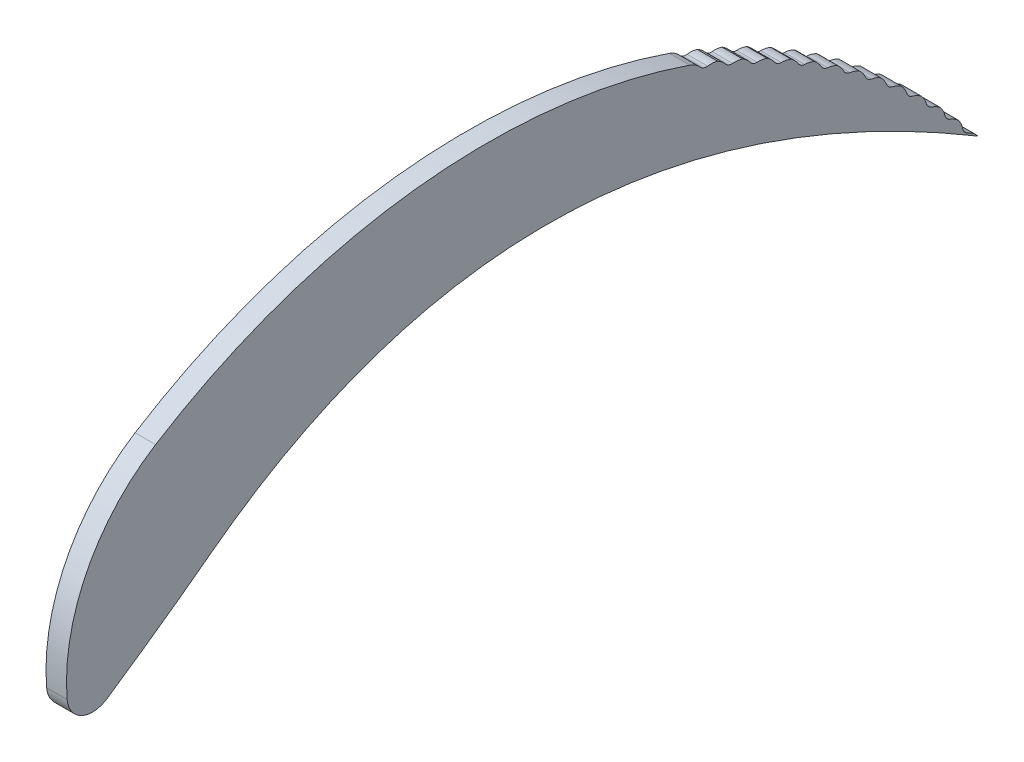
from build123d import *

# Parameters (mm, degrees)
BOSS_EXTRUDE1_DEPTH = 2.54
CUT_EXTRUDE1_START  = -2.54
CUT_EXTRUDE1_DEPTH  = 2.54
CIRPATTERN1_COUNT   = 27
CIRPATTERN1_ANGLE   = 65
FILLET1_R           = 3.048


with BuildPart() as part:
    # Sketch1 → Boss-Extrude1 (new body)
    with BuildSketch(Plane(origin=(0, 0, 0), x_dir=(0, 0, -1), z_dir=(1, 0, 0))):
        with BuildLine():
            ThreePointArc((-43.381076299, 12.030901448), (11.033243319, 22.702964816), (58.576421759, -5.83573347))
            add(Edge.make_bspline(
                [(-36.400312003, -2.96377669), (3.456833979, 27.156600716), (58.576421759, -5.83573347)],
                knots=[0, 0, 0, 1, 1, 1], degree=2))
            ThreePointArc((-36.400312003, -2.96377669), (-42.843357456, -7.694652529), (-49.414438561, -12.246016505))
            ThreePointArc((-49.414438561, -12.246016505), (-52.563618606, -12.471871328), (-54.350611077, -9.868987685))
            ThreePointArc((-54.350611077, -9.868987685), (-51.929499525, 2.615525346), (-43.381076299, 12.030901448))
        make_face()
    extrude(amount=BOSS_EXTRUDE1_DEPTH)

    # Sketch2 → Cut-Extrude1 (cut)
    with BuildSketch(Plane(origin=(2.54, 0, 0), x_dir=(0, 0, -1), z_dir=(1, 0, 0)).offset(CUT_EXTRUDE1_START)):
        with BuildLine():
            ThreePointArc((25.551250128, 18.666636018), (25.832723904, 19.021035399), (25.93313959, 19.462332462))
            ThreePointArc((25.93313959, 19.462332462), (24.821637158, 20.47810228), (23.909811979, 19.279853215))
            ThreePointArc((23.909811989, 19.279853244), (24.732270015, 18.977899406), (25.55125014, 18.666636047))
        make_face()
        with BuildLine():
            ThreePointArc((25.55125014, 18.666636047), (24.732270015, 18.977899406), (23.909811989, 19.279853244))
            ThreePointArc((23.909811979, 19.279853215), (24.556324155, 18.506933739), (25.551250128, 18.666636018))
        make_face()
    cut_extrude1 = extrude(amount=CUT_EXTRUDE1_DEPTH, mode=Mode.SUBTRACT)

    # CirPattern1: Cut-Extrude1 ×27 about axis
    cirpattern1_axis = Axis((0, -53.378286458, 2.29893888), (-1, 0, 0))
    for i in range(1, CIRPATTERN1_COUNT):
        add(cut_extrude1.rotate(cirpattern1_axis, i * CIRPATTERN1_ANGLE / (CIRPATTERN1_COUNT - 1)), mode=Mode.SUBTRACT)

    # Fillet1
    # the kernel refuses this fillet: 3.048 mm, written as the material it takes off along each edge
    with BuildSketch(Plane(origin=(5.330131359, -4.91064789, -57.842493504), x_dir=(0, -0.7831380255895678, -0.6218479178027966), z_dir=(-1, 0, 0)), Plane(origin=(5.330131359, 18.666635995, -25.5512501), x_dir=(0, -0.3672934659287651, -0.9301051069024593), z_dir=(-1, 0, 0)), Plane(origin=(5.330131359, 17.383257012, -28.667298272), x_dir=(0, -0.40751449888321617, -0.913198736968006), z_dir=(-1, 0, 0)), Plane(origin=(5.330131359, 15.965179408, -31.724400451), x_dir=(0, -0.4469598048274426, -0.8945540413349069), z_dir=(-1, 0, 0)), Plane(origin=(5.330131359, 14.415102576, -34.71673727), x_dir=(0, -0.48555429737964134, -0.8742065112410012), z_dir=(-1, 0, 0)), Plane(origin=(5.330131359, 12.735977175, -37.638612645), x_dir=(0, -0.5232245097296833, -0.8521948793662941), z_dir=(-1, 0, 0)), Plane(origin=(5.330131359, 10.930999516, -40.484464621), x_dir=(0, -0.5598987344873042, -0.8285610461031312), z_dir=(-1, 0, 0)), Plane(origin=(5.330131359, 9.003605475, -43.248875957), x_dir=(0, -0.5955071601812754, -0.8033499997963732), z_dir=(-1, 0, 0)), Plane(origin=(5.330131359, 6.957463958, -45.926584439), x_dir=(0, -0.6299820041494215, -0.776609731105578), z_dir=(-1, 0, 0)), Plane(origin=(5.330131359, 4.79646991, -48.512492896), x_dir=(0, -0.663257641566846, -0.7483911416520008), z_dir=(-1, 0, 0)), Plane(origin=(5.330131359, 2.524736907, -51.001678904), x_dir=(0, -0.6952707303664444, -0.7187479471245193), z_dir=(-1, 0, 0)), Plane(origin=(5.330131359, 0.146589322, -53.389404158), x_dir=(0, -0.7259603318141797, -0.6877365750287285), z_dir=(-1, 0, 0)), Plane(origin=(5.330131359, -2.333445906, -55.671123485), x_dir=(0, -0.7552680265094119, -0.6554160572739871), z_dir=(-1, 0, 0))) as fillet1_piece_1:
        with BuildLine():
            CenterArc((1.094032194, 3.047920456), FILLET1_R, 240.878460026, 29.535478311)
            ThreePointArc((-0.389319175, 0.385220188), (-0.168317676, 0.2192323), (0, 0))
            ThreePointArc((0, 0), (0.558026272, -0.002015763), (1.116052544, 0))
        make_face()
    extrude(amount=8.120262718, mode=Mode.SUBTRACT)
    with BuildSketch(Plane(origin=(-2.790131315, 19.27985318, -23.909811985), x_dir=(0, -0.8996941201267986, -0.43652089321046916), z_dir=(1, 0, 0)), Plane(origin=(-2.790131315, 18.067489074, -27.0541706), x_dir=(0, -0.917878584614337, -0.39686131570912947), z_dir=(1, 0, 0)), Plane(origin=(-2.790131315, 16.719123874, -30.142653902), x_dir=(0, -0.9343158150472597, -0.35644629013720247), z_dir=(1, 0, 0)), Plane(origin=(-2.790131315, 15.23732427, -33.169382789), x_dir=(0, -0.9489745222231959, -0.3153527487929306), z_dir=(1, 0, 0)), Plane(origin=(-2.790131315, 13.62491095, -36.12859571), x_dir=(0, -0.9618268024599005, -0.27365891556783495), z_dir=(1, 0, 0)), Plane(origin=(-2.790131315, 11.884953236, -39.014659634), x_dir=(0, -0.9728481907114557, -0.23144415704322063), z_dir=(1, 0, 0)), Plane(origin=(-2.790131315, 10.020763236, -41.822080775), x_dir=(0, -0.982017707138919, -0.18878883141123673), z_dir=(1, 0, 0)), Plane(origin=(-2.790131315, 8.035889542, -44.545515048), x_dir=(0, -0.9893178970466047, -0.1457741355086141), z_dir=(1, 0, 0)), Plane(origin=(-2.790131315, 5.934110473, -47.179778241), x_dir=(0, -0.9947348641081103, -0.10248195025378501), z_dir=(1, 0, 0)), Plane(origin=(-2.790131315, 3.719426885, -49.719855883), x_dir=(0, -0.9982582968187538, -0.05899468478194456), z_dir=(1, 0, 0)), Plane(origin=(-2.790131315, -1.031583847, -54.498302279), x_dir=(0, -0.9996013481872734, 0.028233751117859005), z_dir=(1, 0, 0)), Plane(origin=(-2.790131315, -3.558867172, -56.72757499), x_dir=(0, -0.9974184102705359, 0.07180887726038374), z_dir=(1, 0, 0))) as fillet1_piece_2:
        with BuildLine():
            CenterArc((1.366088814, -2.936073381), FILLET1_R, 105.575244384, 29.535478311)
            ThreePointArc((-0.793333618, -0.784980924), (-0.398084606, -0.391057579), (0, 0))
            ThreePointArc((0, 0), (0.273844853, -0.037451811), (0.547689705, 0))
        make_face()
    extrude(amount=8.120262631, mode=Mode.SUBTRACT)
    with BuildSketch(Plane(origin=(-2.790131315, 1.396054555, -52.160912793), x_dir=(0, 0.6999264755180646, 0.7142149038411757), z_dir=(1, 0, 0))) as fillet1_piece_3:
        with BuildLine():
            CenterArc((1.094032194, 3.047920456), FILLET1_R, 240.878460026, 29.535478311)
            ThreePointArc((-0.389319175, 0.385220188), (-0.168317676, 0.2192323), (0, 0))
            ThreePointArc((0, 0), (0.558026272, -0.002015763), (1.116052544, 0))
        make_face()
    extrude(amount=8.120262631, mode=Mode.SUBTRACT)


solid = part.part
